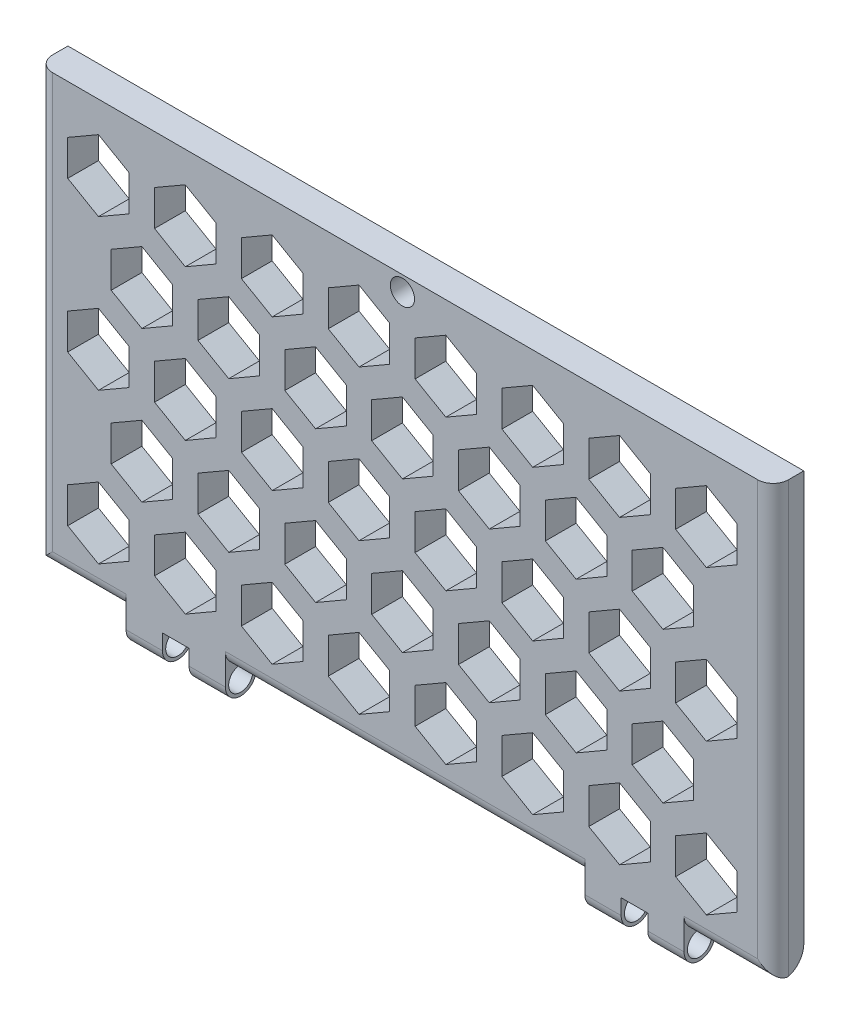
from build123d import *

# Parameters (mm, degrees)
SKETCH1_W               = 60.8
SKETCH1_H               = 38.1
BOSS_EXTRUDE1_DEPTH     = 2.54
CUT_EXTRUDE1_DEPTH      = 2.54
FILL_PATTERN1_DEPTH     = 2.54
SKETCH3_W               = 7.35
SKETCH3_H               = 2.55
SKETCH3_W_2             = 2.2
CUT_EXTRUDE2_DEPTH      = 2.54
FILLET1_R               = 1.27
FILLET2_START           = -14.85
FILLET2_DEPTH           = 29.7
FILLET2_START_2         = -31
FILLET2_2_DEPTH         = 7.95
FILLET2_START_3         = 23.05
FILLET2_3_DEPTH         = 7.95
FILLET2_START_4         = -20.05
FILLET2_4_DEPTH         = 2.2
FILLET2_START_5         = 17.85
FILLET2_5_DEPTH         = 2.2
SKETCH4_R               = 1
CUT_EXTRUDE3_DEPTH      = 36.965457039
CUT_EXTRUDE4_DEPTH      = 57.800146127
CUT_EXTRUDE4_DEPTH_BACK = 57.800146127
SKETCH5_R               = 1


with BuildPart() as part:
    # Sketch1 → Boss-Extrude1 (new body)
    with BuildSketch(Plane.XY):
        Rectangle(SKETCH1_W, SKETCH1_H)
    extrude(amount=BOSS_EXTRUDE1_DEPTH)

    # Sketch2 → Cut-Extrude1 (cut)
    with BuildSketch(Plane.XY.offset(2.54)):
        Polygon((-27.876207471, 15.043530316), (-27.876207471, 12.110590949), (-25.336207471, 10.644121265), (-22.796207471, 12.110590949), (-22.796207471, 15.043530316), (-25.336207471, 16.51), align=None)
    extrude(amount=-CUT_EXTRUDE1_DEPTH, mode=Mode.SUBTRACT)

    # Fill Pattern1: read off the stored shape, not the designer's step
    # Fill Pattern1 outline → Fill Pattern1 (cut)
    with BuildSketch(Plane.XY):
        Polygon((-25.336207471, 4.082309144), (-27.876207471, 2.615839461), (-27.876207471, -0.317099907), (-25.336207471, -1.78356959), (-22.796207471, -0.317099907), (-22.796207471, 2.615839461), align=None)
        Polygon((-25.336207471, -8.345381711), (-27.876207471, -9.811851395), (-27.876207471, -12.744790762), (-25.336207471, -14.211260446), (-22.796207471, -12.744790762), (-22.796207471, -9.811851395), align=None)
        Polygon((20.254576494, -12.744790762), (20.254576494, -9.811851395), (17.714576494, -8.345381711), (15.174576494, -9.811851395), (15.174576494, -12.744790762), (17.714576494, -14.211260446), align=None)
        Polygon((-1.270815489, -0.317099907), (-1.270815489, 2.615839461), (-3.810815489, 4.082309144), (-6.350815489, 2.615839461), (-6.350815489, -0.317099907), (-3.810815489, -1.78356959), align=None)
        Polygon((-12.03351148, 5.896745521), (-12.03351148, 8.829684889), (-14.57351148, 10.296154572), (-17.11351148, 8.829684889), (-17.11351148, 5.896745521), (-14.57351148, 4.430275837), align=None)
        Polygon((9.491880502, -6.530945334), (9.491880502, -3.598005967), (6.951880502, -2.131536283), (4.411880502, -3.598005967), (4.411880502, -6.530945334), (6.951880502, -7.997415018), align=None)
        Polygon((-1.270815489, 15.043530316), (-3.810815489, 16.51), (-6.350815489, 15.043530316), (-6.350815489, 12.110590949), (-3.810815489, 10.644121265), (-1.270815489, 12.110590949), align=None)
        Polygon((-12.03351148, -6.530945334), (-12.03351148, -3.598005967), (-14.57351148, -2.131536283), (-17.11351148, -3.598005967), (-17.11351148, -6.530945334), (-14.57351148, -7.997415018), align=None)
        Polygon((-1.270815489, -12.744790762), (-1.270815489, -9.811851395), (-3.810815489, -8.345381711), (-6.350815489, -9.811851395), (-6.350815489, -12.744790762), (-3.810815489, -14.211260446), align=None)
        Polygon((17.714576494, 16.51), (15.174576494, 15.043530316), (15.174576494, 12.110590949), (17.714576494, 10.644121265), (20.254576494, 12.110590949), (20.254576494, 15.043530316), align=None)
        Polygon((17.714576494, 4.082309144), (15.174576494, 2.615839461), (15.174576494, -0.317099907), (17.714576494, -1.78356959), (20.254576494, -0.317099907), (20.254576494, 2.615839461), align=None)
        Polygon((21.302141824, -2.131536283), (18.762141824, -3.598005967), (18.762141824, -6.530945334), (21.302141824, -7.997415018), (23.842141824, -6.530945334), (23.842141824, -3.598005967), align=None)
        Polygon((21.302141824, 10.296154572), (18.762141824, 8.829684889), (18.762141824, 5.896745521), (21.302141824, 4.430275837), (23.842141824, 5.896745521), (23.842141824, 8.829684889), align=None)
        Polygon((13.079445833, -9.811851395), (10.539445833, -8.345381711), (7.999445833, -9.811851395), (7.999445833, -12.744790762), (10.539445833, -14.211260446), (13.079445833, -12.744790762), align=None)
        Polygon((2.316749842, 5.896745521), (2.316749842, 8.829684889), (-0.223250158, 10.296154572), (-2.763250158, 8.829684889), (-2.763250158, 5.896745521), (-0.223250158, 4.430275837), align=None)
        Polygon((-8.44594615, 12.110590949), (-8.44594615, 15.043530316), (-10.98594615, 16.51), (-13.52594615, 15.043530316), (-13.52594615, 12.110590949), (-10.98594615, 10.644121265), align=None)
        Polygon((13.079445833, -0.317099907), (13.079445833, 2.615839461), (10.539445833, 4.082309144), (7.999445833, 2.615839461), (7.999445833, -0.317099907), (10.539445833, -1.78356959), align=None)
        Polygon((24.889707154, 4.082309144), (22.349707154, 2.615839461), (22.349707154, -0.317099907), (24.889707154, -1.78356959), (27.429707154, -0.317099907), (27.429707154, 2.615839461), align=None)
        Polygon((24.889707154, -8.345381711), (22.349707154, -9.811851395), (22.349707154, -12.744790762), (24.889707154, -14.211260446), (27.429707154, -12.744790762), (27.429707154, -9.811851395), align=None)
        Polygon((24.889707154, 16.51), (22.349707154, 15.043530316), (22.349707154, 12.110590949), (24.889707154, 10.644121265), (27.429707154, 12.110590949), (27.429707154, 15.043530316), align=None)
        Polygon((16.667011163, -3.598005967), (14.127011163, -2.131536283), (11.587011163, -3.598005967), (11.587011163, -6.530945334), (14.127011163, -7.997415018), (16.667011163, -6.530945334), align=None)
        Polygon((5.904315172, -9.811851395), (3.364315172, -8.345381711), (0.824315172, -9.811851395), (0.824315172, -12.744790762), (3.364315172, -14.211260446), (5.904315172, -12.744790762), align=None)
        Polygon((16.667011163, 5.896745521), (16.667011163, 8.829684889), (14.127011163, 10.296154572), (11.587011163, 8.829684889), (11.587011163, 5.896745521), (14.127011163, 4.430275837), align=None)
        Polygon((5.904315172, 12.110590949), (5.904315172, 15.043530316), (3.364315172, 16.51), (0.824315172, 15.043530316), (0.824315172, 12.110590949), (3.364315172, 10.644121265), align=None)
        Polygon((-4.858380819, 5.896745521), (-4.858380819, 8.829684889), (-7.398380819, 10.296154572), (-9.938380819, 8.829684889), (-9.938380819, 5.896745521), (-7.398380819, 4.430275837), align=None)
        Polygon((-15.621076811, 12.110590949), (-15.621076811, 15.043530316), (-18.161076811, 16.51), (-20.701076811, 15.043530316), (-20.701076811, 12.110590949), (-18.161076811, 10.644121265), align=None)
        Polygon((5.904315172, -0.317099907), (5.904315172, 2.615839461), (3.364315172, 4.082309144), (0.824315172, 2.615839461), (0.824315172, -0.317099907), (3.364315172, -1.78356959), align=None)
        Polygon((9.491880502, 8.829684889), (6.951880502, 10.296154572), (4.411880502, 8.829684889), (4.411880502, 5.896745521), (6.951880502, 4.430275837), (9.491880502, 5.896745521), align=None)
        Polygon((-10.98594615, 4.082309144), (-13.52594615, 2.615839461), (-13.52594615, -0.317099907), (-10.98594615, -1.78356959), (-8.44594615, -0.317099907), (-8.44594615, 2.615839461), align=None)
        Polygon((-10.98594615, -8.345381711), (-13.52594615, -9.811851395), (-13.52594615, -12.744790762), (-10.98594615, -14.211260446), (-8.44594615, -12.744790762), (-8.44594615, -9.811851395), align=None)
        Polygon((-19.208642141, -3.598005967), (-21.748642141, -2.131536283), (-24.288642141, -3.598005967), (-24.288642141, -6.530945334), (-21.748642141, -7.997415018), (-19.208642141, -6.530945334), align=None)
        Polygon((13.079445833, 15.043530316), (10.539445833, 16.51), (7.999445833, 15.043530316), (7.999445833, 12.110590949), (10.539445833, 10.644121265), (13.079445833, 12.110590949), align=None)
        Polygon((-19.208642141, 5.896745521), (-19.208642141, 8.829684889), (-21.748642141, 10.296154572), (-24.288642141, 8.829684889), (-24.288642141, 5.896745521), (-21.748642141, 4.430275837), align=None)
        Polygon((2.316749842, -6.530945334), (2.316749842, -3.598005967), (-0.223250158, -2.131536283), (-2.763250158, -3.598005967), (-2.763250158, -6.530945334), (-0.223250158, -7.997415018), align=None)
        Polygon((-7.398380819, -2.131536283), (-9.938380819, -3.598005967), (-9.938380819, -6.530945334), (-7.398380819, -7.997415018), (-4.858380819, -6.530945334), (-4.858380819, -3.598005967), align=None)
        Polygon((-15.621076811, 2.615839461), (-18.161076811, 4.082309144), (-20.701076811, 2.615839461), (-20.701076811, -0.317099907), (-18.161076811, -1.78356959), (-15.621076811, -0.317099907), align=None)
        Polygon((-15.621076811, -9.811851395), (-18.161076811, -8.345381711), (-20.701076811, -9.811851395), (-20.701076811, -12.744790762), (-18.161076811, -14.211260446), (-15.621076811, -12.744790762), align=None)
    extrude(amount=FILL_PATTERN1_DEPTH, mode=Mode.SUBTRACT)

    # Sketch3 → Cut-Extrude2 (cut)
    with BuildSketch(Plane.XY.offset(2.54)):
        with Locations((-26.725, -17.775)):
            Rectangle(SKETCH3_W, SKETCH3_H)
        with Locations((-18.95, -17.775)):
            Rectangle(SKETCH3_W_2, SKETCH3_H)
        Polygon((-14.85, -16.5), (-14.85, -19.05), (0, -19.05), (14.85, -19.05), (14.85, -16.5), (0, -16.5), align=None)
        with Locations((18.95, -17.775)):
            Rectangle(SKETCH3_W_2, SKETCH3_H)
        with Locations((26.725, -17.775)):
            Rectangle(SKETCH3_W, SKETCH3_H)
    extrude(amount=-CUT_EXTRUDE2_DEPTH, mode=Mode.SUBTRACT)

    # Fillet1
    fillet1_edges = [part.edges().sort_by_distance(p)[0] for p in [
        (-26.725, -16.5, 2.54),
        (0, -16.5, 2.54),
        (26.725, -16.5, 2.54),
        (30.4, 1.275, 2.54),
        (-30.4, 1.275, 2.54),
        (16.35, -19.05, 0),
        (-16.35, -19.05, 0),
        (-21.55, -19.05, 0),
        (21.55, -19.05, 2.54),
        (16.35, -19.05, 2.54),
        (-16.35, -19.05, 2.54),
        (-21.55, -19.05, 2.54),
        (21.55, -19.05, 0),
    ]]
    fillet(fillet1_edges, radius=FILLET1_R - 0.0001)  # a hair under: the kernel refuses the full size

    # Fillet2: read off the stored shape, not the designer's step
    # Fillet2 outline → Fillet2 (cut)
    with BuildSketch(Plane.YZ.offset(FILLET2_START)):
        with BuildLine():
            Line((-16.5, 0), (-14.796116201, 0))
            ThreePointArc((-14.796116201, 0), (-15.858674435, 0.352428536), (-16.5, 1.27))
            Line((-16.5, 1.27), (-16.5, 0))
        make_face()
    extrude(amount=FILLET2_DEPTH, mode=Mode.SUBTRACT)

    # Fillet2 2 outline → Fillet2 2 (cut)
    with BuildSketch(Plane.YZ.offset(FILLET2_START_2)):
        with BuildLine():
            Line((-16.5, 0), (-14.796116201, 0))
            ThreePointArc((-14.796116201, 0), (-15.858674435, 0.352428536), (-16.5, 1.27))
            Line((-16.5, 1.27), (-16.5, 0))
        make_face()
    extrude(amount=FILLET2_2_DEPTH, mode=Mode.SUBTRACT)

    # Fillet2 3 outline → Fillet2 3 (cut)
    with BuildSketch(Plane.YZ.offset(FILLET2_START_3)):
        with BuildLine():
            Line((-16.5, 0), (-14.796116201, 0))
            ThreePointArc((-14.796116201, 0), (-15.858674435, 0.352428536), (-16.5, 1.27))
            Line((-16.5, 1.27), (-16.5, 0))
        make_face()
    extrude(amount=FILLET2_3_DEPTH, mode=Mode.SUBTRACT)

    # Fillet2 4 outline → Fillet2 4 (cut)
    with BuildSketch(Plane.YZ.offset(FILLET2_START_4)):
        with BuildLine():
            Line((-16.5, 0), (-14.722, 0))
            ThreePointArc((-14.722, 0), (-15.979235857, 0.520764143), (-16.5, 1.778))
            Line((-16.5, 1.778), (-16.5, 0))
        make_face()
    extrude(amount=FILLET2_4_DEPTH, mode=Mode.SUBTRACT)

    # Fillet2 5 outline → Fillet2 5 (cut)
    with BuildSketch(Plane.YZ.offset(FILLET2_START_5)):
        with BuildLine():
            Line((-16.5, 0), (-14.722, 0))
            ThreePointArc((-14.722, 0), (-15.979235857, 0.520764143), (-16.5, 1.778))
            Line((-16.5, 1.778), (-16.5, 0))
        make_face()
    extrude(amount=FILLET2_5_DEPTH, mode=Mode.SUBTRACT)

    # Sketch4 → Cut-Extrude3 (cut, through all)
    with BuildSketch(Plane(origin=(0, 0, 0), x_dir=(-1, 0, 0), z_dir=(0, 0, -1))):
        with Locations((0.223250158, 17.8)):
            Circle(SKETCH4_R)
    extrude(amount=-CUT_EXTRUDE3_DEPTH, mode=Mode.SUBTRACT)

    # Sketch5 → Cut-Extrude4 (cut, two sides: drawn at the far end of the back side and taken through both)
    with BuildSketch(Plane(origin=(23.05, 0, 0), x_dir=(0, 0, -1), z_dir=(1, 0, 0)).offset(-CUT_EXTRUDE4_DEPTH_BACK)):
        with Locations((-1.27, -17.78)):
            Circle(SKETCH5_R)
    extrude(amount=CUT_EXTRUDE4_DEPTH + CUT_EXTRUDE4_DEPTH_BACK, mode=Mode.SUBTRACT)


solid = part.part
